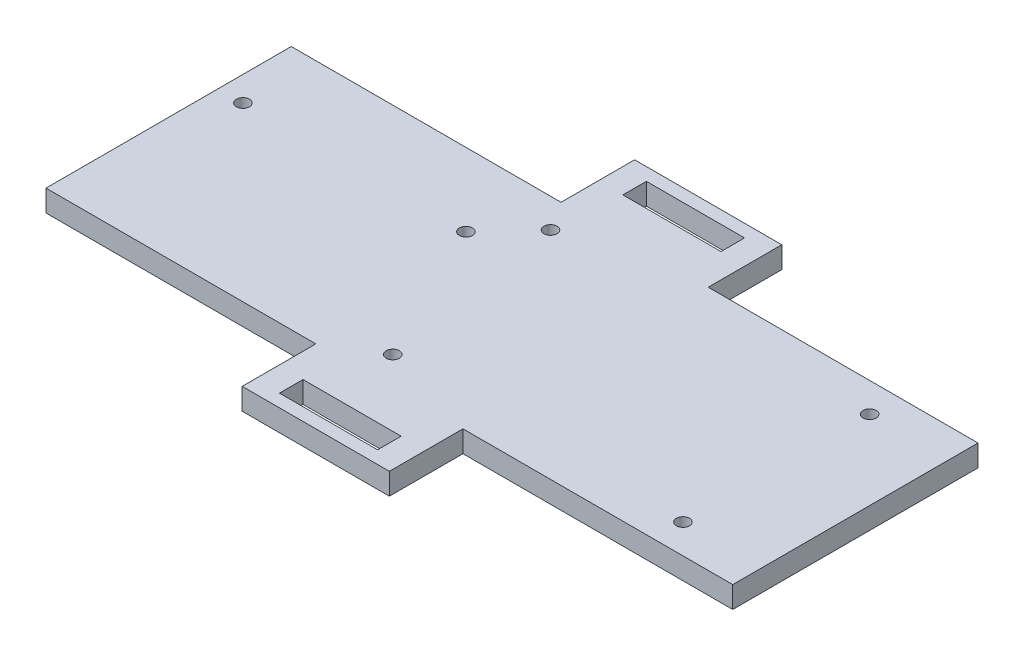
from build123d import *

# Parameters (mm, degrees)
BOSS_EXTRUDE1_DEPTH  = 5.588
SKETCH2_W            = 25.4
SKETCH2_H            = 6.096
CUT_EXTRUDE1_DEPTH   = 103.543043372
M3_CLEARANCE_HOLE1_D = 3.4
M3_CLEARANCE_HOLE2_D = 3.4


with BuildPart() as part:
    # Sketch1 → Boss-Extrude1 (new body)
    with BuildSketch(Plane(origin=(0, 0, 0), x_dir=(1, 0, 0), z_dir=(0, 1, 0))):
        Polygon((19.05, 31.75), (19.05, 50.8), (-19.05, 50.8), (-19.05, 31.75), (-88.9, 31.75), (-88.9, -31.75), (-19.05, -31.75), (-19.05, -50.8), (19.05, -50.8), (19.05, -31.75), (88.9, -31.75), (88.9, 31.75), align=None)
    extrude(amount=BOSS_EXTRUDE1_DEPTH)

    # Sketch2 → Cut-Extrude1 (cut, through all)
    with BuildSketch(Plane(origin=(0, 5.588, 0), x_dir=(1, 0, 0), z_dir=(0, 1, 0))):
        with Locations((0, 44.45)):
            Rectangle(SKETCH2_W, SKETCH2_H)
        with Locations((0, -44.45)):
            Rectangle(SKETCH2_W, SKETCH2_H)
    extrude(amount=-CUT_EXTRUDE1_DEPTH, mode=Mode.SUBTRACT)

    # M3 Clearance Hole1 (through all)
    with Locations(Plane(origin=(0, 5.588, 0), x_dir=(1, 0, 0), z_dir=(0, 1, 0))):
        with Locations((-14.1986, 24.1681), (68.4276, 24.1681), (68.4276, -24.1681), (-6.7056, -24.1681)):
            Hole(M3_CLEARANCE_HOLE1_D / 2)

    # M3 Clearance Hole2 (through all)
    with Locations(Plane(origin=(0, 5.588, 0), x_dir=(1, 0, 0), z_dir=(0, 1, 0))):
        with Locations((-24.765, 12.827), (-82.4865, 12.827)):
            Hole(M3_CLEARANCE_HOLE2_D / 2)


solid = part.part
